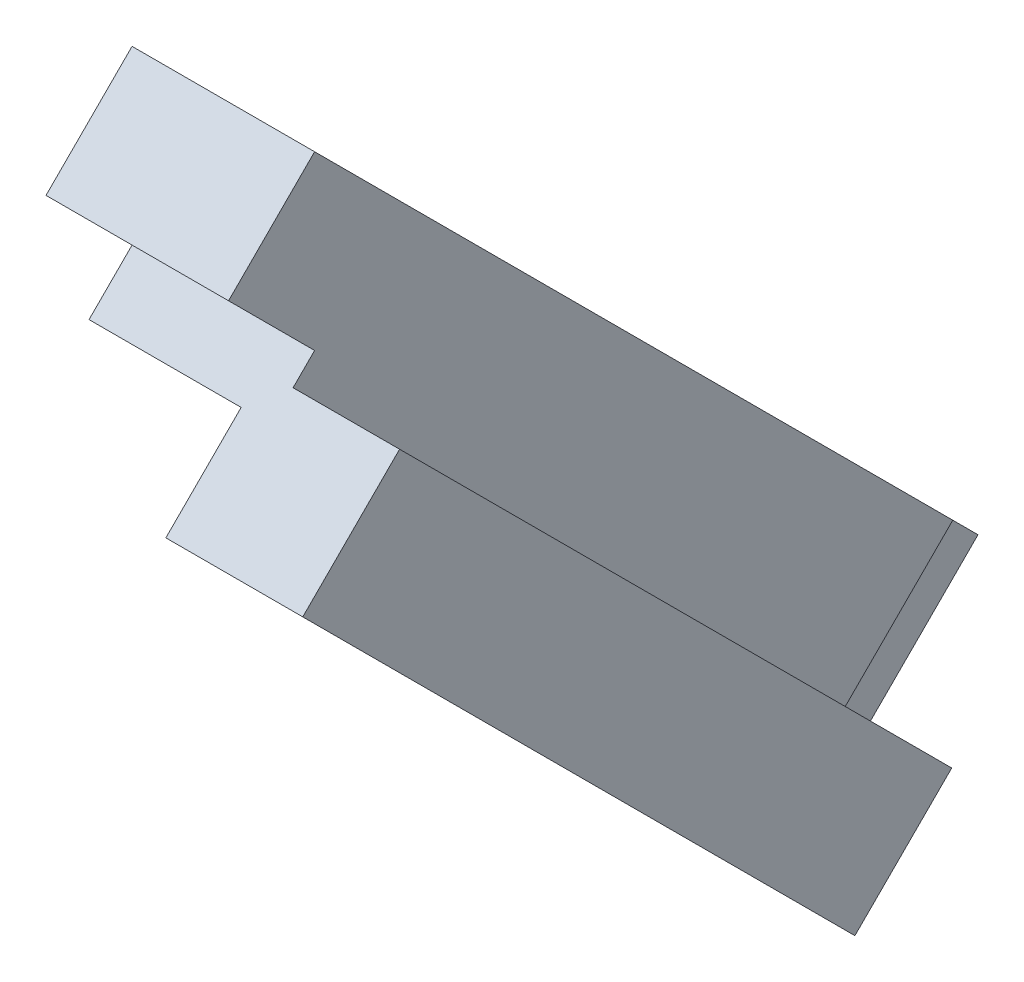
from build123d import *
from build123d.topology import SkipClean

# Parameters (mm, degrees)
STOCK_GOUX_START         = 70.287130926
STOCK_GOUX_LIKED_1_DEPTH = 33.663747278
SKETCH1_W                = 5.499999668
SKETCH1_H                = 5.499999668
BOSS_EXTRUDE1_DEPTH      = 33.663747
SKETCH2_W                = 5.500000112
SKETCH2_H                = 4
CUT_EXTRUDE1_DEPTH       = 158.309385227
SKETCH3_R                = 0.6
CUT_EXTRUDE2_DEPTH       = 157.569401119
CIRPATTERN1_COUNT        = 2
CUT_EXTRUDE3_DEPTH       = 0.4


# Read off the part's stored shape, not the designer's step: Stock-Goux Liked-1
with BuildPart() as part:
    # Stock-Goux Liked-1 outline → Stock-Goux Liked-1 (new body)
    with BuildSketch(Plane(origin=(0, 0, 0), x_dir=(1, 0, 0), z_dir=(0, 0.707106781186548, 0.707106781186547)).offset(STOCK_GOUX_START)):
        Polygon((109.20487811, -113.704878), (113.704878, -113.704878), (113.704878, -109.20487811), (110.204877888, -109.20487811), (110.204877888, -104.204878204), (109.704877872, -104.204878204), (109.704877872, -109.704877872), (104.204878204, -109.704877872), (104.204878204, -110.204877888), (109.20487811, -110.204877888), align=None)
    extrude(amount=STOCK_GOUX_LIKED_1_DEPTH)

    # Sketch1 → Boss-Extrude1 (add)
    with SkipClean():  # the faces are left unmerged after this step: merging them gives an invalid solid
        with BuildSketch(Plane(origin=(0, 73.504370888, 73.504370888), x_dir=(1, 0, 0), z_dir=(0, 0.7071067811865468, 0.7071067811865482))):
            with Locations((106.954878038, -106.954878038)):
                Rectangle(SKETCH1_W, SKETCH1_H)
        extrude(amount=-BOSS_EXTRUDE1_DEPTH)

    # Sketch2 → Cut-Extrude1 (cut, symmetric)
    with BuildSketch(Plane(origin=(0, -77.926616474, 77.926616474), x_dir=(1, 0, 0), z_dir=(7.211287694214923e-15, -0.7071067811865551, 0.70710678118654))):
        with Locations((110.954877944, 72.287130926)):
            Rectangle(SKETCH2_W, SKETCH2_H)
    cut_extrude1 = extrude(amount=CUT_EXTRUDE1_DEPTH, both=True, mode=Mode.SUBTRACT)

    # Sketch3 → Cut-Extrude2 (cut, through all)
    with BuildSketch(Plane(origin=(108.204877888, 0, 0), x_dir=(0, 0, -1), z_dir=(1, 0, 0))):
        with Locations(Location((-126.566463401, -24.33702246, 0), (0, 0, 90))):
            Circle(SKETCH3_R)
    cut_extrude2 = extrude(amount=-CUT_EXTRUDE2_DEPTH, mode=Mode.SUBTRACT)

    # CirPattern1: Cut-Extrude1, Cut-Extrude2 ×2 about axis
    cirpattern1_axis = Axis((0, 61.602438898, 61.602438898), (0.7071067811865476, -0.5000000000000002, 0.49999999999999983))
    add([cut_extrude1.rotate(cirpattern1_axis, i * 360 / CIRPATTERN1_COUNT) for i in range(1, CIRPATTERN1_COUNT)], mode=Mode.SUBTRACT)
    add([cut_extrude2.rotate(cirpattern1_axis, i * 360 / CIRPATTERN1_COUNT) for i in range(1, CIRPATTERN1_COUNT)], mode=Mode.SUBTRACT)

    # Sketch4 → Cut-Extrude3 (cut)
    with BuildSketch(Plane.ZY.offset(-104.204878204)):
        with BuildLine():
            add(Edge.make_bspline(
                [(137.366263177, -15.536641958), (137.384382572, -15.591549308), (137.419782315, -15.69882144), (137.459186977, -15.859049442), (137.49214112, -16.012386008), (137.514000677, -16.160253488), (137.524986633, -16.302187523), (137.528833833, -16.438231017), (137.519232786, -16.56791361), (137.501672897, -16.692100033), (137.474816199, -16.811211655), (137.43877634, -16.926345187), (137.394877807, -17.038141977), (137.340247851, -17.145404199), (137.279762453, -17.250240782), (137.208801408, -17.350858418), (137.130871876, -17.44922078), (137.071710788, -17.509644521), (137.041894186, -17.540097487)],
                knots=[0, 0, 0, 0, 1.287822378, 2.516010175, 3.674063788, 4.781691461, 5.843233308, 6.844856983, 7.810778634, 8.736691482, 9.637439608, 10.527922747, 11.42265571, 12.309925548, 13.20759656, 14.117022994, 15.05099826, 16, 16, 16, 16], degree=3))
            add(Edge.make_bspline(
                [(137.041894186, -17.540097487), (136.998960511, -17.581221973), (136.913862111, -17.662734395), (136.774321369, -17.769191949), (136.628913623, -17.862510079), (136.476967143, -17.942470408), (136.316942399, -18.005239017), (136.151457136, -18.056954069), (135.978831204, -18.092776668), (135.861160681, -18.105040188), (135.801659811, -18.111241317)],
                knots=[0, 0, 0, 0, 1.022008825, 2.025713258, 3.01306579, 3.991759542, 4.973709284, 5.965765121, 6.971375826, 8, 8, 8, 8], degree=3))
            add(Edge.make_bspline(
                [(135.801659811, -18.111241317), (135.727848936, -18.114360513), (135.581575084, -18.120541943), (135.362918243, -18.097188161), (135.148316942, -18.050715715), (134.937930872, -17.975710171), (134.732334445, -17.874135163), (134.530827153, -17.746975786), (134.332059719, -17.595279106), (134.208814688, -17.477331901), (134.145469907, -17.416710067)],
                knots=[0, 0, 0, 0, 0.954411477, 1.891393961, 2.83483847, 3.788855937, 4.772399019, 5.794968863, 6.866670633, 8, 8, 8, 8], degree=3))
            add(Edge.make_bspline(
                [(134.145469907, -17.416710067), (134.087301165, -17.355639465), (133.97417316, -17.23686785), (133.824393296, -17.049660186), (133.700033869, -16.859206335), (133.600067826, -16.666625668), (133.524301652, -16.472232299), (133.472081243, -16.276059425), (133.447200893, -16.077186683), (133.444709706, -15.878372558), (133.463793476, -15.683684616), (133.494797448, -15.495884083), (133.541562437, -15.317223999), (133.604913128, -15.148822456), (133.679524991, -14.988357417), (133.770701407, -14.837757089), (133.875819213, -14.695723239), (133.957133225, -14.610228436), (133.997913818, -14.567351093)],
                knots=[0, 0, 0, 0, 1.266403576, 2.462932918, 3.595230427, 4.677622218, 5.716026896, 6.723182253, 7.718508806, 8.718470104, 9.703288732, 10.652924589, 11.575150168, 12.471866133, 13.352171177, 14.229221933, 15.111919616, 16, 16, 16, 16], degree=3))
            add(Edge.make_bspline(
                [(133.997913818, -14.567351093), (134.0293321, -14.537249249), (134.091218463, -14.477955948), (134.189885481, -14.397057781), (134.292964278, -14.325780905), (134.400212442, -14.263861283), (134.5100637, -14.208074996), (134.624688581, -14.162472776), (134.743535408, -14.125968035), (134.866035211, -14.095680705), (134.994266769, -14.07738369), (135.128120636, -14.066426123), (135.268911043, -14.068621368), (135.4154773, -14.080029271), (135.568524019, -14.101766051), (135.726908858, -14.135951692), (135.892972735, -14.176930391), (136.004118046, -14.213015713), (136.061155004, -14.231533785)],
                knots=[0, 0, 0, 0, 0.941646764, 1.854814777, 2.758663323, 3.651256701, 4.533788624, 5.42349862, 6.317647985, 7.223730787, 8.151860389, 9.118407791, 10.128096724, 11.196015397, 12.299359275, 13.471241831, 14.702305393, 16, 16, 16, 16], degree=3))
            add(Edge.make_bspline(
                [(136.061155004, -14.231533785), (136.03783081, -14.151023365), (135.992804073, -13.995600139), (135.961746415, -13.761048295), (135.957483709, -13.53737718), (135.98609062, -13.324155526), (136.041631829, -13.124049991), (136.124166661, -12.938707562), (136.230835364, -12.768359294), (136.321152128, -12.670307426), (136.366443465, -12.621137151)],
                knots=[0, 0, 0, 0, 1.163026674, 2.245192069, 3.276123062, 4.262521083, 5.22298603, 6.15124475, 7.072900833, 8, 8, 8, 8], degree=3))
            add(Edge.make_bspline(
                [(136.366443465, -12.621137151), (136.416820974, -12.574890711), (136.517824264, -12.482169919), (136.695990773, -12.37294272), (136.892144739, -12.285611387), (137.106291516, -12.224557422), (137.330938052, -12.188619531), (137.561204645, -12.183357027), (137.793164709, -12.210546427), (138.023826708, -12.270056686), (138.249438099, -12.355377263), (138.463317732, -12.469797933), (138.663854241, -12.610341945), (138.783720428, -12.722248883), (138.844368145, -12.778869523)],
                knots=[0, 0, 0, 0, 0.893644292, 1.791692663, 2.721245645, 3.698154088, 4.69853899, 5.692571982, 6.704201475, 7.746416452, 8.804306481, 9.854916457, 10.914669584, 12, 12, 12, 12], degree=3))
            add(Edge.make_bspline(
                [(138.844368145, -12.778869523), (138.899395873, -12.837755957), (139.007972553, -12.953946353), (139.142149802, -13.150510303), (139.251487067, -13.35937793), (139.329975882, -13.580784344), (139.3851195, -13.806131138), (139.406146977, -14.033524738), (139.399038039, -14.259361854), (139.360804669, -14.480956712), (139.294687579, -14.6922013), (139.205525499, -14.889891735), (139.08950233, -15.069611444), (138.993885904, -15.174086192), (138.946130965, -15.226265356)],
                knots=[0, 0, 0, 0, 1.066800828, 2.104933201, 3.142943896, 4.182839012, 5.210561903, 6.209775075, 7.199366311, 8.197108877, 9.179992245, 10.12547414, 11.063781507, 12, 12, 12, 12], degree=3))
            add(Edge.make_bspline(
                [(138.946130965, -15.226265356), (138.895216773, -15.273141228), (138.795101053, -15.365316151), (138.625128403, -15.476213485), (138.442491752, -15.556133113), (138.249188489, -15.611368014), (138.043610911, -15.633870341), (137.826942044, -15.631517775), (137.598642767, -15.598486452), (137.445608681, -15.557758626), (137.366263177, -15.536641958)],
                knots=[0, 0, 0, 0, 0.976858676, 1.920857554, 2.851700144, 3.785065739, 4.750519099, 5.763235174, 6.840276451, 8, 8, 8, 8], degree=3))
        make_face()
        with BuildLine():
            add(Edge.make_bspline(
                [(138.390251558, -13.18973691), (138.359813087, -13.160319366), (138.300260095, -13.10276382), (138.203826313, -13.027867161), (138.105917901, -12.961846747), (138.003553745, -12.908707212), (137.898902716, -12.865177957), (137.791745764, -12.831563511), (137.681215474, -12.810126832), (137.569225051, -12.798893716), (137.458099059, -12.797449762), (137.350708723, -12.806168312), (137.248356142, -12.825213023), (137.151015585, -12.854476546), (137.058615418, -12.894531876), (136.970767484, -12.943780889), (136.888289186, -13.004483467), (136.838329728, -13.051399353), (136.81292784, -13.075253737)],
                knots=[0, 0, 0, 0, 1.153345825, 2.256525798, 3.324245021, 4.368806591, 5.395038832, 6.411588186, 7.425043215, 8.459189127, 9.476592696, 10.451053976, 11.392023347, 12.309986167, 13.216226714, 14.132513687, 15.050476507, 16, 16, 16, 16], degree=3))
            add(Edge.make_bspline(
                [(136.81292784, -13.075253737), (136.789517614, -13.100680665), (136.743057955, -13.151142644), (136.682429676, -13.234652025), (136.632769986, -13.325390911), (136.593797066, -13.422598318), (136.56241555, -13.525403674), (136.542661815, -13.634674048), (136.532458654, -13.750478027), (136.532786231, -13.870477528), (136.542456511, -13.991400833), (136.563270939, -14.108703387), (136.591995975, -14.221967621), (136.633127155, -14.330006452), (136.684031967, -14.433665612), (136.745725951, -14.531506939), (136.81583369, -14.626026588), (136.870377536, -14.68323136), (136.898154202, -14.712363112)],
                knots=[0, 0, 0, 0, 0.91734365, 1.820549368, 2.732695169, 3.656923812, 4.597403426, 5.58239753, 6.599811386, 7.6807907, 8.765516921, 9.817005095, 10.841188329, 11.863884905, 12.881111811, 13.90281608, 14.932000932, 16, 16, 16, 16], degree=3))
            add(Edge.make_bspline(
                [(136.898154202, -14.712363112), (136.935868915, -14.747349052), (137.010792721, -14.816851896), (137.138458881, -14.902074388), (137.275850821, -14.971660369), (137.422527129, -15.023271669), (137.574237296, -15.056369227), (137.72689603, -15.069308509), (137.878995721, -15.062098419), (138.02733024, -15.031924339), (138.169467487, -14.987173098), (138.299138894, -14.925905819), (138.416450267, -14.852016698), (138.483087532, -14.791003009), (138.516183048, -14.760700452)],
                knots=[0, 0, 0, 0, 1.033201928, 2.052552341, 3.074574245, 4.123699385, 5.170708477, 6.189024034, 7.196535734, 8.221683312, 9.224855385, 10.18612672, 11.0991366, 12, 12, 12, 12], degree=3))
            add(Edge.make_bspline(
                [(138.516183048, -14.760700452), (138.538015699, -14.737907787), (138.581530318, -14.692479764), (138.635257654, -14.615252922), (138.683354808, -14.534464527), (138.723124847, -14.447624439), (138.752751758, -14.354716703), (138.776576345, -14.257081467), (138.789657531, -14.153858626), (138.796384329, -14.046351963), (138.793552015, -13.936134848), (138.774935293, -13.826091906), (138.744321381, -13.71669653), (138.699222885, -13.608634067), (138.641542635, -13.501401405), (138.571133774, -13.395169899), (138.486459029, -13.290721977), (138.422958632, -13.224068194), (138.390251558, -13.18973691)],
                knots=[0, 0, 0, 0, 0.859224433, 1.712518804, 2.557077351, 3.420954658, 4.30923577, 5.212064549, 6.156981658, 7.141240852, 8.147518387, 9.154725018, 10.175701212, 11.238298814, 12.339856676, 13.490829141, 14.707604363, 16, 16, 16, 16], degree=3))
        make_face(mode=Mode.SUBTRACT)
        with BuildLine():
            add(Edge.make_bspline(
                [(136.502551237, -15.12068643), (136.464213099, -15.083879268), (136.388774964, -15.011453646), (136.26591589, -14.917681839), (136.139482773, -14.836495809), (136.007760398, -14.770032117), (135.870968953, -14.717540441), (135.729416552, -14.679469892), (135.583283001, -14.654979644), (135.434628491, -14.64568153), (135.28684316, -14.647235945), (135.143925253, -14.664555048), (135.007400738, -14.691818177), (134.877529747, -14.732681698), (134.754844618, -14.787813975), (134.63909381, -14.855988786), (134.527920177, -14.934208559), (134.462295452, -14.997245749), (134.42913377, -15.029099891)],
                knots=[0, 0, 0, 0, 1.105778885, 2.175846255, 3.211793481, 4.230405104, 5.241991603, 6.257077546, 7.277371057, 8.321486389, 9.354533115, 10.34992635, 11.314300325, 12.249628111, 13.178265938, 14.107952245, 15.043904763, 16, 16, 16, 16], degree=3))
            add(Edge.make_bspline(
                [(134.42913377, -15.029099891), (134.390521708, -15.070880661), (134.313375122, -15.154358298), (134.22079881, -15.298635764), (134.147301205, -15.455523129), (134.095889359, -15.62384748), (134.066275435, -15.798717792), (134.061975165, -15.97710111), (134.086181912, -16.15583773), (134.133066722, -16.334841342), (134.20638368, -16.510814223), (134.304241211, -16.682111915), (134.425576729, -16.848863922), (134.522061268, -16.950905083), (134.571601718, -17.003298609)],
                knots=[0, 0, 0, 0, 0.924030296, 1.846205005, 2.775062971, 3.73508078, 4.700116031, 5.652245842, 6.625895568, 7.624752618, 8.654661343, 9.717290307, 10.827931717, 12, 12, 12, 12], degree=3))
            add(Edge.make_bspline(
                [(134.571601718, -17.003298609), (134.612070931, -17.042208677), (134.690657412, -17.11776748), (134.817115241, -17.216352931), (134.944899665, -17.301149434), (135.077232997, -17.368483662), (135.211390292, -17.423043192), (135.34890032, -17.460925053), (135.489150107, -17.484353555), (135.630785271, -17.491569371), (135.770776991, -17.48478436), (135.906369473, -17.467699409), (136.035384147, -17.436809252), (136.158389688, -17.394444675), (136.276149676, -17.341355531), (136.386897135, -17.274402647), (136.492695036, -17.196586666), (136.556595605, -17.13588884), (136.589049635, -17.10506143)],
                knots=[0, 0, 0, 0, 1.192905526, 2.316483069, 3.404188558, 4.448474118, 5.467989243, 6.478496282, 7.474461727, 8.485611991, 9.487313933, 10.451223935, 11.387112887, 12.302277834, 13.214017268, 14.127760184, 15.049120709, 16, 16, 16, 16], degree=3))
            add(Edge.make_bspline(
                [(136.589049635, -17.10506143), (136.618560462, -17.073415651), (136.677069742, -17.010673537), (136.752311668, -16.907044345), (136.815132896, -16.796446229), (136.866619919, -16.678965032), (136.903891095, -16.554032149), (136.931495961, -16.423056818), (136.944566345, -16.284915316), (136.947401787, -16.14197296), (136.93722445, -15.99765619), (136.914759873, -15.856583562), (136.878458894, -15.72042405), (136.830787858, -15.589058502), (136.767508176, -15.463746228), (136.691595638, -15.343678244), (136.604587084, -15.227298619), (136.536815128, -15.156487068), (136.502551237, -15.12068643)],
                knots=[0, 0, 0, 0, 0.944058104, 1.871725224, 2.788006072, 3.716688801, 4.665455454, 5.629499403, 6.634454943, 7.68994399, 8.747865978, 9.788843788, 10.803769579, 11.820087617, 12.834379937, 13.861768024, 14.918960718, 16, 16, 16, 16], degree=3))
        make_face(mode=Mode.SUBTRACT)
    extrude(amount=-CUT_EXTRUDE3_DEPTH, mode=Mode.SUBTRACT)


solid = part.part
